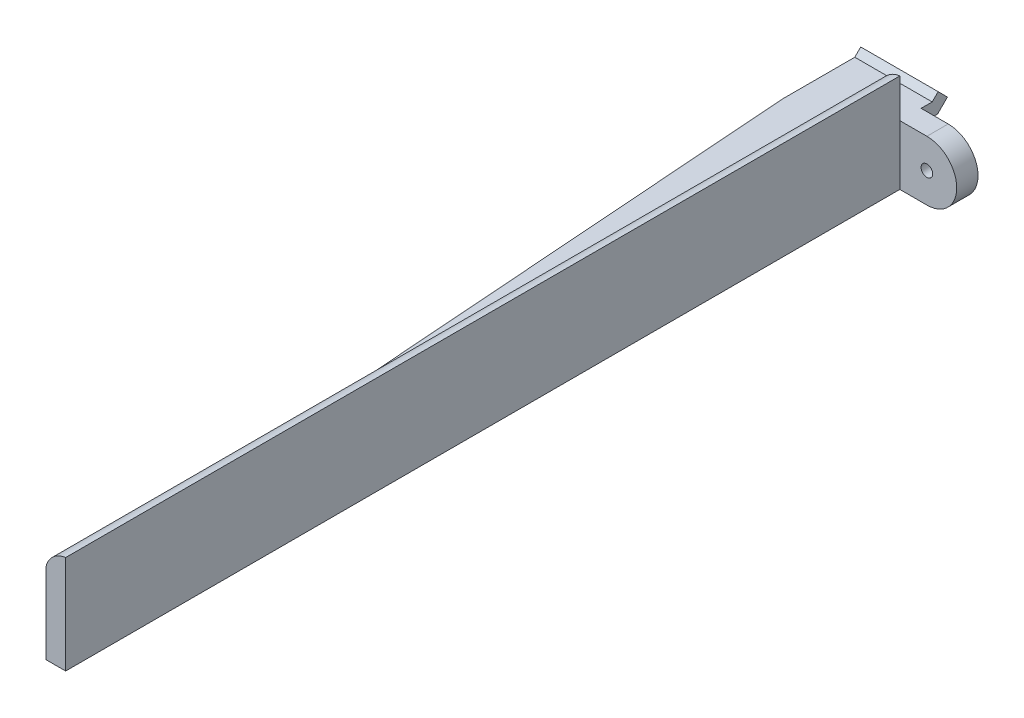
from build123d import *

# Parameters (mm, degrees)
SKETCH2_W            = 10
SKETCH2_H            = 14.768412439
BOSS_EXTRUDE1_DEPTH  = 5
BOSS_EXTRUDE4_DEPTH  = 10
SKETCH9_W            = 10
SKETCH9_H            = 3.18
SKETCH9_H_2          = 3.888412439
CUT_EXTRUDE3_DEPTH   = 5
BOSS_EXTRUDE5_DEPTH  = 7.7
SKETCH12_R           = 0.75
BOSS_EXTRUDE7_DEPTH  = 2.75
FILLET1_R            = 2.5
SKETCH13_W           = 17.887250462
SKETCH13_H           = 46.229219396
CUT_EXTRUDE4_DEPTH   = 20
SKETCH15_W           = 10
SKETCH15_H           = 7.7
BOSS_EXTRUDE9_DEPTH  = 100
CUT_EXTRUDE5_DEPTH   = 100
SKETCH17_W           = 2.538779858
SKETCH17_H           = 107.754476916
BOSS_EXTRUDE10_DEPTH = 5
FILLET2_R            = 3
FILLET3_R            = 3


with BuildPart() as part:
    # Sketch2 → Boss-Extrude1 (new body)
    with BuildSketch(Plane.XY):
        with Locations((0, 1.566049366)):
            Rectangle(SKETCH2_W, SKETCH2_H)
    extrude(amount=BOSS_EXTRUDE1_DEPTH)

    # Sketch8 → Boss-Extrude4 (add)
    with BuildSketch(Plane.ZY.offset(5)):
        Polygon((-0.15, 5.770255585), (0, 5.770255585), (0, 4.070255585), (-0.15, 4.070255585), (-2.137867966, 4.070255585), (-3.402081528, 5.334469147), (-2.2, 6.536550675), (-1.43370491, 5.770255585), align=None)
        Polygon((-0.15, -1.929744415), (0, -1.929744415), (0, -0.229744415), (-0.15, -0.229744415), (-1.43370491, -0.229744415), (-2.2, 0.536550675), (-3.402081528, -0.665530853), (-2.137867966, -1.929744415), align=None)
    extrude(amount=-BOSS_EXTRUDE4_DEPTH)

    # Sketch9 → Cut-Extrude3 (cut)
    with BuildSketch(Plane(origin=(0, 0, 0), x_dir=(-1, 0, 0), z_dir=(0, 0, -1))):
        with Locations((0, 7.360255585)):
            Rectangle(SKETCH9_W, SKETCH9_H)
        with Locations((0, -3.873950635)):
            Rectangle(SKETCH9_W, SKETCH9_H_2)
    extrude(amount=-CUT_EXTRUDE3_DEPTH, mode=Mode.SUBTRACT)

    # Sketch10 → Boss-Extrude5 (add)
    with BuildSketch(Plane(origin=(0, 5.770255585, 0), x_dir=(1, 0, 0), z_dir=(0, 1, 0))):
        with BuildLine():
            Line((-5, -5), (-5, -10.5))
            Line((-5, -10.5), (1.352445729, -55.7))
            Line((1.352445729, -55.7), (6.352445729, -55.7))
            Line((6.352445729, -55.7), (6.352445729, -49.2))
            ThreePointArc((6.352445729, -49.2), (1.383429579, -31.764936646), (5, -14))
            Line((5, -14), (5, -5))
            Line((5, -5), (-5, -5))
        make_face()
    extrude(amount=-BOSS_EXTRUDE5_DEPTH)

    # Sketch12 → Boss-Extrude7 (add)
    with BuildSketch(Plane.XY):
        with BuildLine():
            Line((5, 5.770255585), (8.5, 5.770255585))
            ThreePointArc((8.5, 5.770255585), (12.35, 1.920255585), (8.5, -1.929744415))
            Line((8.5, -1.929744415), (5, -1.929744415))
            Line((5, -1.929744415), (5, 5.770255585))
        make_face()
        with Locations((8.5, 1.920255585)):
            Circle(SKETCH12_R, mode=Mode.SUBTRACT)
    extrude(amount=BOSS_EXTRUDE7_DEPTH)

    # Fillet1
    fillet1_edges = [part.edges().sort_by_distance(p)[0] for p in [
        (6.352445729, 1.920255585, 49.2),
        (5, 1.920255585, 14),
        (1.352445729, 1.920255585, 55.7),
        (6.352445729, 1.920255585, 55.7),
    ]]
    fillet(fillet1_edges, radius=FILLET1_R)

    # Sketch13 → Cut-Extrude4 (cut)
    with BuildSketch(Plane(origin=(0, 5.770255585, 0), x_dir=(1, 0, 0), z_dir=(0, 1, 0))):
        with Locations((3.943625231, -33.614609698)):
            Rectangle(SKETCH13_W, SKETCH13_H)
    extrude(amount=-CUT_EXTRUDE4_DEPTH, mode=Mode.SUBTRACT)

    # Sketch15 → Boss-Extrude9 (add)
    with BuildSketch(Plane.XY.offset(10.5)):
        with Locations((0, 1.920255585)):
            Rectangle(SKETCH15_W, SKETCH15_H)
    extrude(amount=BOSS_EXTRUDE9_DEPTH)

    # Sketch16 → Cut-Extrude5 (cut)
    with BuildSketch(Plane(origin=(0, 5.770255585, 0), x_dir=(1, 0, 0), z_dir=(0, 1, 0))):
        Polygon((-5, -7.952810564), (2.461220142, -110.5), (-5, -110.5), align=None)
    extrude(amount=-CUT_EXTRUDE5_DEPTH, mode=Mode.SUBTRACT)

    # Sketch17 → Boss-Extrude10 (add)
    with BuildSketch(Plane(origin=(0, 5.770255585, 0), x_dir=(1, 0, 0), z_dir=(0, 1, 0))):
        with Locations((3.730610071, -56.622761542)):
            Rectangle(SKETCH17_W, SKETCH17_H)
    extrude(amount=BOSS_EXTRUDE10_DEPTH)

    # Fillet2
    fillet2_edges = [part.edges().sort_by_distance(p)[0] for p in [
        (2.461220142, 5.770255585, 56.622761542),
    ]]
    fillet(fillet2_edges, radius=FILLET2_R)

    # Fillet3
    # the kernel refuses this fillet: 3 mm, written as the material it takes off along each edge
    with BuildSketch(Plane(origin=(2.461220142, 10.770255585, 116.846949644), x_dir=(-0.016047608738208652, -0.9998712288358863, 0), z_dir=(0, 0, -1))) as fillet3_piece_1:
        with BuildLine():
            CenterArc((2.92841725, -2.967518469), FILLET3_R, 98.438939572, 73.338315122)
            Line((-0.040741346, -2.538452936), (-0.337657205, -2.495546383))
            ThreePointArc((-0.337657205, -2.495546383), (-0.320332042, -1.264412185), (-0.299961369, 0.004814283))
            Line((-0.299961369, 0.004814283), (0.004814283, 0.299961369))
            ThreePointArc((0.004814283, 0.299961369), (2.00455674, 0.267866151), (2.444124669, 0.296751847))
            Line((2.444124669, 0.296751847), (2.488151267, 0))
        make_face()
    extrude(amount=120.448376205, mode=Mode.SUBTRACT)


solid = part.part
